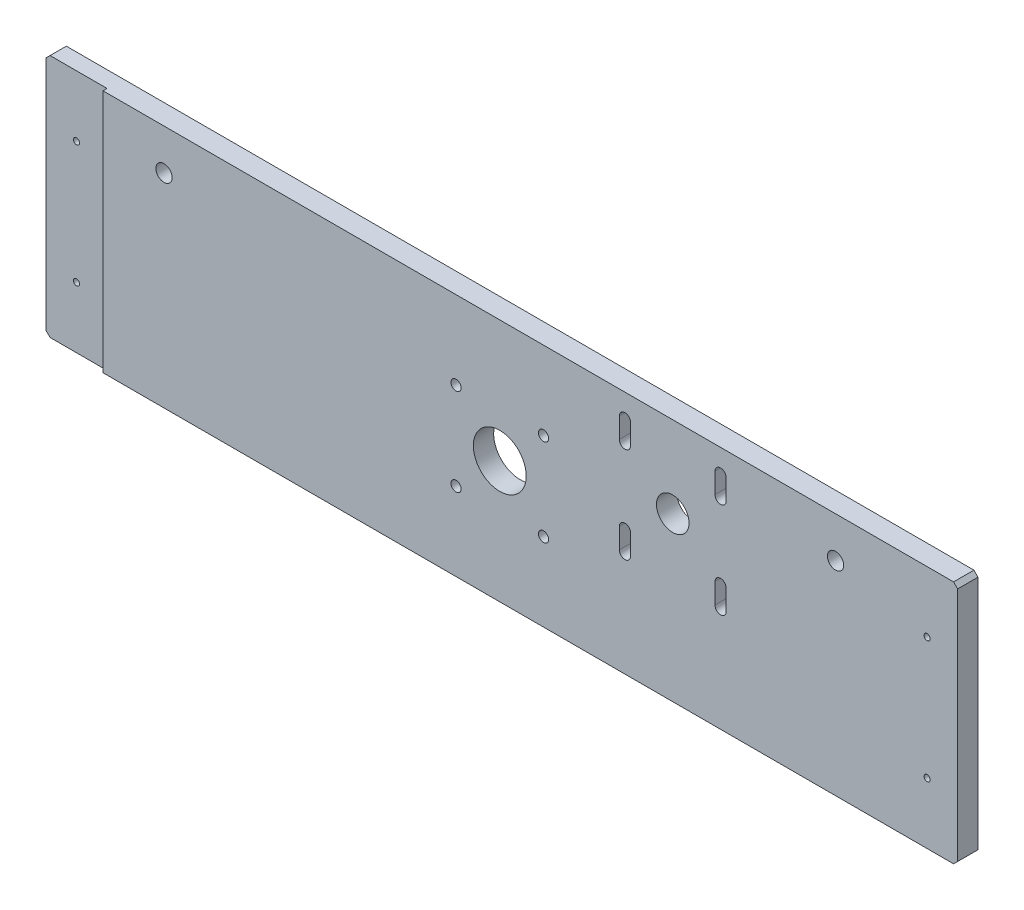
from build123d import *

# Parameters (mm, degrees)
SCHIZZO1_R                   = 13
SCHIZZO1_R_2                 = 4
SCHIZZO1_R_3                 = 1.5
SCHIZZO1_R_4                 = 2.5
SCHIZZO1_R_5                 = 8
ESTRUSIONE_ESTRUSIONE1_DEPTH = 10
SCHIZZO2_W                   = 30
SCHIZZO2_H                   = 120
TAGLIO_ESTRUSIONE1_DEPTH     = 2


with BuildPart() as part:
    # Schizzo1 → Estrusione-Estrusione1 (new body)
    with BuildSketch(Plane.XY):
        Polygon((2, 0), (448, 0), (450, 2), (450, 118), (448, 120), (2, 120), (0, 118), (0, 2), align=None)
        with Locations((225, 60)):
            Circle(SCHIZZO1_R, mode=Mode.SUBTRACT)
        with Locations((390, 100)):
            Circle(SCHIZZO1_R_2, mode=Mode.SUBTRACT)
        with Locations((60, 100)):
            Circle(SCHIZZO1_R_2, mode=Mode.SUBTRACT)
        with Locations((15, 30)):
            Circle(SCHIZZO1_R_3, mode=Mode.SUBTRACT)
        with Locations((435, 30)):
            Circle(SCHIZZO1_R_3, mode=Mode.SUBTRACT)
        with Locations((203.5, 81.5)):
            Circle(SCHIZZO1_R_4, mode=Mode.SUBTRACT)
        with Locations((246.5, 81.5)):
            Circle(SCHIZZO1_R_4, mode=Mode.SUBTRACT)
        with Locations((246.5, 38.5)):
            Circle(SCHIZZO1_R_4, mode=Mode.SUBTRACT)
        with Locations((203.5, 38.5)):
            Circle(SCHIZZO1_R_4, mode=Mode.SUBTRACT)
        with Locations((435, 90)):
            Circle(SCHIZZO1_R_3, mode=Mode.SUBTRACT)
        with Locations((15, 90)):
            Circle(SCHIZZO1_R_3, mode=Mode.SUBTRACT)
        with Locations((310, 80)):
            Circle(SCHIZZO1_R_5, mode=Mode.SUBTRACT)
        with BuildLine():
            Line((330.75, 108.5), (330.75, 98.5))
            ThreePointArc((330.75, 98.5), (333.5, 95.75), (336.25, 98.5))
            Line((336.25, 98.5), (336.25, 108.5))
            ThreePointArc((336.25, 108.5), (333.5, 111.25), (330.75, 108.5))
        make_face(mode=Mode.SUBTRACT)
        with BuildLine():
            Line((289.25, 108.5), (289.25, 98.5))
            ThreePointArc((289.25, 98.5), (286.5, 95.75), (283.75, 98.5))
            Line((283.75, 98.5), (283.75, 108.5))
            ThreePointArc((283.75, 108.5), (286.5, 111.25), (289.25, 108.5))
        make_face(mode=Mode.SUBTRACT)
        with BuildLine():
            Line((330.75, 51.5), (330.75, 61.5))
            ThreePointArc((330.75, 61.5), (333.5, 64.25), (336.25, 61.5))
            Line((336.25, 61.5), (336.25, 51.5))
            ThreePointArc((336.25, 51.5), (333.5, 48.75), (330.75, 51.5))
        make_face(mode=Mode.SUBTRACT)
        with BuildLine():
            Line((289.25, 51.5), (289.25, 61.5))
            ThreePointArc((289.25, 61.5), (286.5, 64.25), (283.75, 61.5))
            Line((283.75, 61.5), (283.75, 51.5))
            ThreePointArc((283.75, 51.5), (286.5, 48.75), (289.25, 51.5))
        make_face(mode=Mode.SUBTRACT)
    extrude(amount=-ESTRUSIONE_ESTRUSIONE1_DEPTH)

    # Schizzo2 → Taglio-Estrusione1 (cut)
    with BuildSketch(Plane.XY):
        with Locations((15, 60)):
            Rectangle(SCHIZZO2_W, SCHIZZO2_H)
        with Locations((615.438855383, 60)):
            Rectangle(SCHIZZO2_W, SCHIZZO2_H)
    extrude(amount=-TAGLIO_ESTRUSIONE1_DEPTH, mode=Mode.SUBTRACT)


solid = part.part
